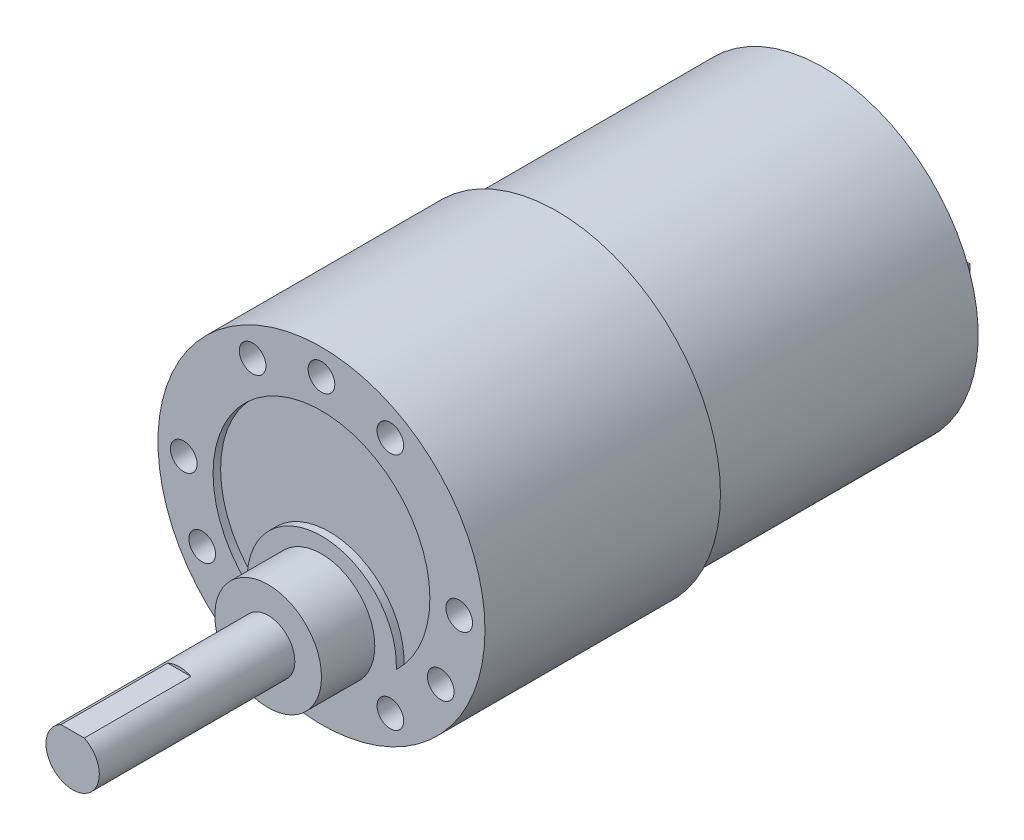
from build123d import *

# Parameters (mm, degrees)
CROQUIS1_R              = 18.4
SALIENTE_EXTRUIR1_DEPTH = 26.5
CORTAR_EXTRUIR2_DEPTH   = 0.85
CROQUIS3_R              = 1.5
CORTAR_EXTRUIR3_DEPTH   = 25
CROQUIS9_R              = 1.5
CORTAR_EXTRUIR4_DEPTH   = 5
CROQUIS22_R             = 6
SALIENTE_EXTRUIR2_DEPTH = 6
CROQUIS24_R             = 3
SALIENTE_EXTRUIR3_DEPTH = 22
CORTAR_EXTRUIR5_START   = -12
CORTAR_EXTRUIR5_DEPTH   = 12
CROQUIS26_R             = 17.4
SALIENTE_EXTRUIR4_DEPTH = 30
CROQUIS27_R             = 3.9
CROQUIS27_R_2           = 2.25
CROQUIS27_W             = 0.5
CROQUIS27_H             = 3
SALIENTE_EXTRUIR5_DEPTH = 1.6
CROQUIS29_W             = 0.5
CROQUIS29_H             = 3
SALIENTE_EXTRUIR6_DEPTH = 5


with BuildPart() as part:
    # Croquis1 → Saliente-Extruir1 (new body)
    with BuildSketch(Plane.XY):
        Circle(CROQUIS1_R)
    extrude(amount=SALIENTE_EXTRUIR1_DEPTH)

    # Croquis2 → Cortar-Extruir2 (cut)
    with BuildSketch(Plane.XY.offset(26.5)):
        with BuildLine():
            ThreePointArc((-8.355713846, -8.889434523), (0, 0), (8.4190219, -8.8295))
            ThreePointArc((8.4190219, -8.8295), (-0.043589152, 12.19992213), (-8.355713846, -8.889434523))
        make_face()
    extrude(amount=-CORTAR_EXTRUIR2_DEPTH, mode=Mode.SUBTRACT)

    # Croquis3 → Cortar-Extruir3 (cut)
    with BuildSketch(Plane.XY.offset(26.5)):
        with Locations((0, 15.5)):
            Circle(CROQUIS3_R)
        with Locations((13.423393759, -7.75)):
            Circle(CROQUIS3_R)
        with Locations((-13.423393759, -7.75)):
            Circle(CROQUIS3_R)
    extrude(amount=-CORTAR_EXTRUIR3_DEPTH, mode=Mode.SUBTRACT)

    # Croquis9 → Cortar-Extruir4 (cut)
    with BuildSketch(Plane.XY.offset(26.5)):
        with Locations((-15.5, 0)):
            Circle(CROQUIS9_R)
        with Locations((-7.75, 13.423393759)):
            Circle(CROQUIS9_R)
        with Locations((7.75, 13.423393759)):
            Circle(CROQUIS9_R)
        with Locations((15.5, 0)):
            Circle(CROQUIS9_R)
        with Locations((7.75, -13.423393759)):
            Circle(CROQUIS9_R)
        with Locations((-7.75, -13.423393759)):
            Circle(CROQUIS9_R)
    extrude(amount=-CORTAR_EXTRUIR4_DEPTH, mode=Mode.SUBTRACT)

    # Croquis22 → Saliente-Extruir2 (add)
    with BuildSketch(Plane.XY.offset(26.5)):
        with Locations((0, -7.75)):
            Circle(CROQUIS22_R)
    extrude(amount=SALIENTE_EXTRUIR2_DEPTH)

    # Croquis24 → Saliente-Extruir3 (add)
    with BuildSketch(Plane.XY.offset(32.5)):
        with Locations((0, -7.75)):
            Circle(CROQUIS24_R)
    extrude(amount=SALIENTE_EXTRUIR3_DEPTH)

    # Croquis25 → Cortar-Extruir5 (cut)
    with BuildSketch(Plane.XY.offset(54.5).offset(CORTAR_EXTRUIR5_START)):
        with BuildLine():
            ThreePointArc((1.307669683, -5.05), (0, -4.75), (-1.307669683, -5.05))
            Line((-1.307669683, -5.05), (1.307669683, -5.05))
        make_face()
    extrude(amount=CORTAR_EXTRUIR5_DEPTH, mode=Mode.SUBTRACT)

    # Croquis26 → Saliente-Extruir4 (add)
    with BuildSketch(Plane(origin=(0, 0, 0), x_dir=(-1, 0, 0), z_dir=(0, 0, -1))):
        Circle(CROQUIS26_R)
    extrude(amount=SALIENTE_EXTRUIR4_DEPTH)

    # Croquis27 → Saliente-Extruir5 (add)
    # profile 1 of 3: a face of its own
    with BuildSketch(Plane(origin=(0, 0, -30), x_dir=(-1, 0, 0), z_dir=(0, 0, -1))):
        Circle(CROQUIS27_R)
    # profile 2 of 3: a face of its own
    with BuildSketch(Plane(origin=(0, 0, -30), x_dir=(-1, 0, 0), z_dir=(0, 0, -1))):
        with Locations((-11.25, 0)):
            Circle(CROQUIS27_R_2)
        with Locations((-11.25, 0)):
            Rectangle(CROQUIS27_W, CROQUIS27_H, mode=Mode.SUBTRACT)
    # profile 3 of 3: a face of its own
    with BuildSketch(Plane(origin=(0, 0, -30), x_dir=(-1, 0, 0), z_dir=(0, 0, -1))):
        with Locations((11.25, 0)):
            Circle(CROQUIS27_R_2)
        with Locations((11.25, 0)):
            Rectangle(CROQUIS27_W, CROQUIS27_H, mode=Mode.SUBTRACT)
    extrude(amount=SALIENTE_EXTRUIR5_DEPTH)

    # Croquis29 → Saliente-Extruir6 (add)
    with BuildSketch(Plane(origin=(0, 0, -30), x_dir=(-1, 0, 0), z_dir=(0, 0, -1))):
        with Locations((-11.25, 0)):
            Rectangle(CROQUIS29_W, CROQUIS29_H)
        with Locations((11.25, 0)):
            Rectangle(CROQUIS29_W, CROQUIS29_H)
    extrude(amount=SALIENTE_EXTRUIR6_DEPTH)


solid = part.part
